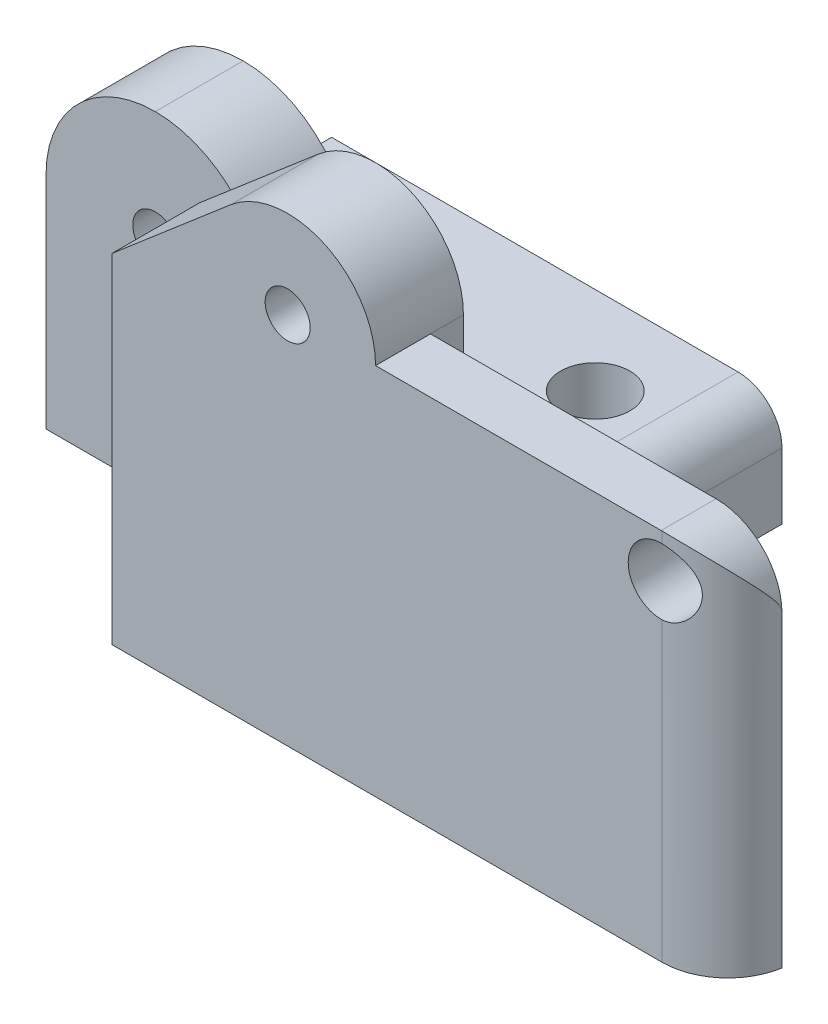
from build123d import *

# Parameters (mm, degrees)
RESSALTO_EXTRUS_O1_DEPTH                  = 20
CORTE_EXTRUS_O1_DEPTH                     = 20
CORTE_EXTRUS_O2_DEPTH                     = 34.12099032335839
RESSALTO_EXTRUS_O2_DEPTH                  = 10
FURO_ROSCADO_PARA_CONDU_TE_DE_M3X0_51_D   = 3.15
ESBO_O20_W                                = 9.95
ESBO_O20_H                                = 4.000000000000002
RESSALTO_EXTRUS_O6_DEPTH                  = 10
FILETE3_R                                 = 4.975
BROCA_DE_ROSQUEAR_PARA_TARRAXA_DE_M2_54_D = 2.05
CORTE_EXTRUS_O3_DEPTH                     = 31.199337741083
FILETE5_R                                 = 2
BROCA_DE_ROSQUEAR_PARA_TARRAXA_DE_M2_55_D = 2.05
ESBO_O30_W                                = 2.5
ESBO_O30_H                                = 17
RESSALTO_EXTRUS_O9_DEPTH                  = 16
FILETE12_R                                = 3
ESBO_O31_R                                = 1.5000000000000009
CORTE_EXTRUS_O4_DEPTH                     = 44.18564583747706


# Some blends are built 0.0001 mm under size
with BuildPart() as part:
    # Esboço1 → Ressalto-extrusão1 (new body)
    with BuildSketch(Plane.XY):
        with BuildLine():
            Line((0, 0), (0, 12))
            Line((0, 12), (9.40008084297598, 20.03980597685765))
            ThreePointArc((9.40008084297598, 20.03980597685765), (13.67336836528959, 20.633158173552044), (16, 17))
            Line((16, 17), (16, 4))
            Line((16, 4), (16, 0))
            Line((16, 0), (0, 0))
        make_face()
    extrude(amount=RESSALTO_EXTRUS_O1_DEPTH)

    # Esboço2 → Corte-extrusão1 (cut)
    with BuildSketch(Plane(origin=(16, 0, 0), x_dir=(0, 0, -1), z_dir=(1, 0, 0))):
        Polygon((0, 5), (-16, 4.999999999999997), (-16, 21), (0, 21), align=None)
    extrude(amount=-CORTE_EXTRUS_O1_DEPTH, mode=Mode.SUBTRACT)

    # Esboço3 → Corte-extrusão2 (cut, through all)
    with BuildSketch(Plane.XY.offset(20)):
        Polygon((0, 0), (4, 0), (4, 15.421164609606624), (0, 12), align=None)
    extrude(amount=-CORTE_EXTRUS_O2_DEPTH, mode=Mode.SUBTRACT)

    # Esboço8 → Ressalto-extrusão2 (add)
    with BuildSketch(Plane.ZY.offset(-4)):
        Polygon((0, 5), (13, 4.999999999999998), (13, 0), (0, 0), align=None)
    extrude(amount=RESSALTO_EXTRUS_O2_DEPTH)

    # Furo roscado para conduíte de M3x0.51 (through all)
    with Locations(Plane(origin=(-2, 0, 4), x_dir=(0, 0, -1), z_dir=(0, -1, 0))):
        with Locations((0, 0), (0, 12), (-10, 12)):
            Hole(FURO_ROSCADO_PARA_CONDU_TE_DE_M3X0_51_D / 2)

    # Esboço20 → Ressalto-extrusão6 (add)
    with BuildSketch(Plane(origin=(0, 5, 8.1e-16), x_dir=(1, 0, 0), z_dir=(0, 1, 1.6e-16))):
        with Locations((-1.025, -11)):
            Rectangle(ESBO_O20_W, ESBO_O20_H)
    extrude(amount=RESSALTO_EXTRUS_O6_DEPTH)

    # Filete3
    filete3_edges = [part.edges().sort_by_distance(p)[0] for p in [
        (3.95, 14.999999999999998, 11.000000000000002),
        (-6, 14.999999999999998, 11.000000000000002),
    ]]
    fillet(filete3_edges, radius=FILETE3_R - 0.0001)  # a hair under: the kernel refuses the full size

    # Broca de rosquear para tarraxa de M2.54 (through all)
    with Locations(Plane.XY.offset(13)):
        with Locations((-1.025, 10.025)):
            Hole(BROCA_DE_ROSQUEAR_PARA_TARRAXA_DE_M2_54_D / 2)

    # Esboço24 → Corte-extrusão3 (cut, through all)
    with BuildSketch(Plane(origin=(0, 5, 8.1e-16), x_dir=(1, 0, 0), z_dir=(0, 1, 1.6e-16))):
        Polygon((16, 8.1e-16), (14.5, -1.8e-16), (14.500000000000002, -15.999999999999996), (16, -15.999999999999996), align=None)
    extrude(amount=-CORTE_EXTRUS_O3_DEPTH, mode=Mode.SUBTRACT)

    # Filete5
    filete5_edges = [part.edges().sort_by_distance(p)[0] for p in [
        (14.5, 4.999999999999999, 7.999999999999999),
    ]]
    fillet(filete5_edges, radius=FILETE5_R)

    # Broca de rosquear para tarraxa de M2.55 (through all)
    with Locations(Plane.XY.offset(20)):
        with Locations((12, 17)):
            Hole(BROCA_DE_ROSQUEAR_PARA_TARRAXA_DE_M2_55_D / 2)

    # Esboço30 → Ressalto-extrusão9 (add)
    with BuildSketch(Plane(origin=(16, 0, 0), x_dir=(0, 0, -1), z_dir=(1, 0, 0))):
        with Locations((-18.75, 8.5)):
            Rectangle(ESBO_O30_W, ESBO_O30_H)
    extrude(amount=RESSALTO_EXTRUS_O9_DEPTH)

    # Filete12
    # the kernel refuses this fillet: 3 mm, written as the material it takes off along each edge
    with BuildSketch(Plane(origin=(32, 17, 10), x_dir=(-1, 0, 0), z_dir=(0, 0, 1))) as filete12_piece_1:
        with BuildLine():
            CenterArc((FILETE12_R, FILETE12_R), FILETE12_R, 180, 90)
            Line((0, FILETE12_R), (-FILETE12_R * 0.02, FILETE12_R))
            Line((-FILETE12_R * 0.02, FILETE12_R), (-FILETE12_R * 0.02, -FILETE12_R * 0.02))
            Line((-FILETE12_R * 0.02, -FILETE12_R * 0.02), (FILETE12_R, -FILETE12_R * 0.02))
            Line((FILETE12_R, -FILETE12_R * 0.02), (FILETE12_R, 0))
        make_face()
    extrude(amount=17.5, mode=Mode.SUBTRACT)
    with BuildSketch(Plane(origin=(32, 24.39509972887527, 20), x_dir=(-1.1653e-13, 0, -1), z_dir=(0, -1, 0))) as filete12_piece_2:
        with BuildLine():
            CenterArc((3.0000000000003446, -2.9580398915497583), FILETE12_R, 99.59406822686617, 80.40593177314054)
            Line((3.447e-13, -2.958039891550108), (-0.05999999999965402, -2.958039891550115))
            Line((-0.05999999999965402, -2.958039891550115), (-0.05999999999999872, -6.99e-15))
            Line((-0.05999999999999872, -6.99e-15), (-6.99e-15, 0.06000000000000227))
            ThreePointArc((-6.99e-15, 0.06000000000000227), (1.250000000000018, 0.06000000000014793), (2.4900000000000446, 0.05916079783099687))
            Line((2.4900000000000446, 0.05916079783099687), (2.5000000000000497, 0))
        make_face()
    extrude(amount=31.79019945775054, mode=Mode.SUBTRACT)

    # Esboço31 → Corte-extrusão4 (cut, through all)
    with BuildSketch(Plane.XY.offset(20)):
        with Locations((29, 15.000000000000002)):
            Circle(ESBO_O31_R)
    extrude(amount=-CORTE_EXTRUS_O4_DEPTH, mode=Mode.SUBTRACT)


solid = part.part
